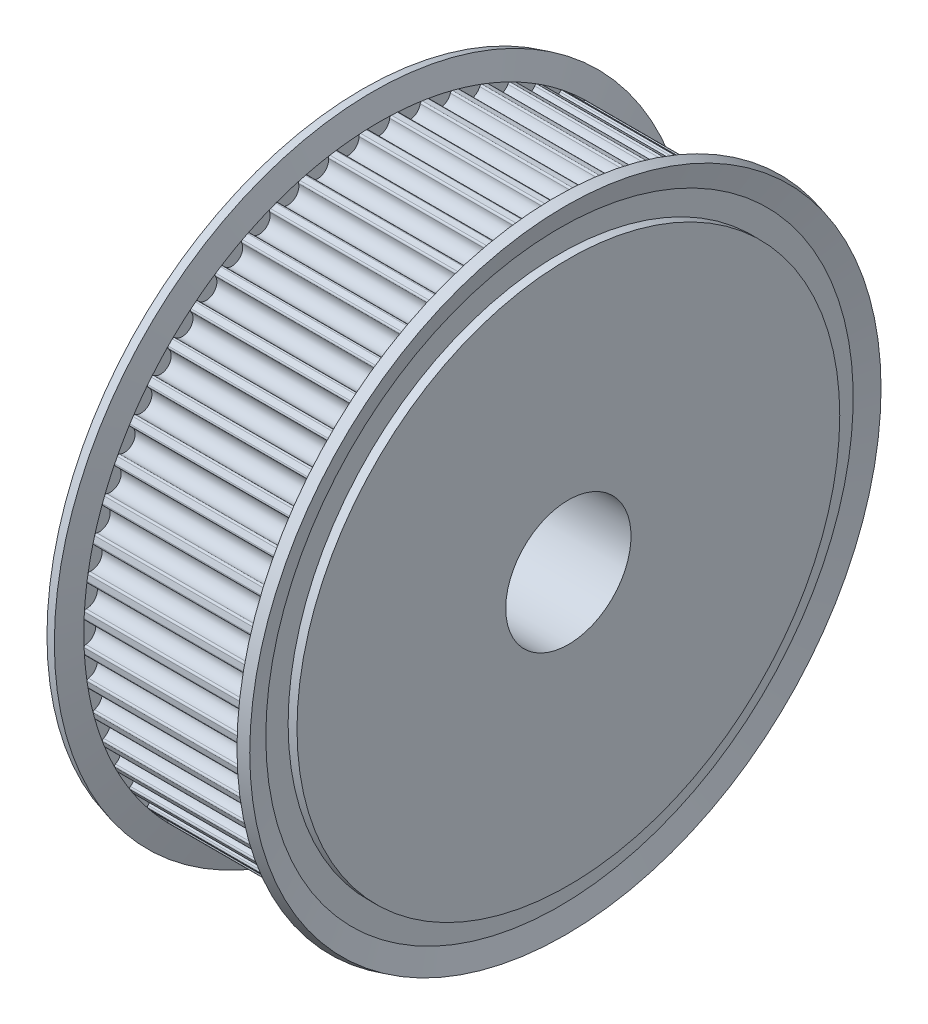
from build123d import *

# Parameters (mm, degrees)
CUT_EXTRUDE1_DEPTH       = 8.15
CUT_EXTRUDE1_DEPTH_BACK  = 8.15
CUT_EXTRUDE2_DEPTH       = 8.15
CUT_EXTRUDE2_DEPTH_BACK  = 8.15
CUT_EXTRUDE3_DEPTH       = 8.15
CUT_EXTRUDE3_DEPTH_BACK  = 8.15
CUT_EXTRUDE4_DEPTH       = 8.15
CUT_EXTRUDE4_DEPTH_BACK  = 8.15
CUT_EXTRUDE5_DEPTH       = 8.15
CUT_EXTRUDE5_DEPTH_BACK  = 8.15
CUT_EXTRUDE6_DEPTH       = 8.15
CUT_EXTRUDE6_DEPTH_BACK  = 8.15
CUT_EXTRUDE7_DEPTH       = 8.15
CUT_EXTRUDE7_DEPTH_BACK  = 8.15
CUT_EXTRUDE8_DEPTH       = 8.15
CUT_EXTRUDE8_DEPTH_BACK  = 8.15
CUT_EXTRUDE9_DEPTH       = 8.15
CUT_EXTRUDE9_DEPTH_BACK  = 8.15
CUT_EXTRUDE10_DEPTH      = 8.15
CUT_EXTRUDE10_DEPTH_BACK = 8.15
CUT_EXTRUDE11_DEPTH      = 8.15
CUT_EXTRUDE11_DEPTH_BACK = 8.15
CUT_EXTRUDE12_DEPTH      = 8.15
CUT_EXTRUDE12_DEPTH_BACK = 8.15
CUT_EXTRUDE13_DEPTH      = 8.15
CUT_EXTRUDE13_DEPTH_BACK = 8.15
CUT_EXTRUDE14_DEPTH      = 8.15
CUT_EXTRUDE14_DEPTH_BACK = 8.15
CUT_EXTRUDE15_DEPTH      = 8.15
CUT_EXTRUDE15_DEPTH_BACK = 8.15
CUT_EXTRUDE16_DEPTH      = 8.15
CUT_EXTRUDE16_DEPTH_BACK = 8.15
CUT_EXTRUDE17_DEPTH      = 8.15
CUT_EXTRUDE17_DEPTH_BACK = 8.15
CUT_EXTRUDE18_DEPTH      = 8.15
CUT_EXTRUDE18_DEPTH_BACK = 8.15
CUT_EXTRUDE19_DEPTH      = 8.15
CUT_EXTRUDE19_DEPTH_BACK = 8.15
CUT_EXTRUDE20_DEPTH      = 8.15
CUT_EXTRUDE20_DEPTH_BACK = 8.15
CUT_EXTRUDE21_DEPTH      = 8.15
CUT_EXTRUDE21_DEPTH_BACK = 8.15
CUT_EXTRUDE22_DEPTH      = 8.15
CUT_EXTRUDE22_DEPTH_BACK = 8.15
CUT_EXTRUDE23_DEPTH      = 8.15
CUT_EXTRUDE23_DEPTH_BACK = 8.15
CUT_EXTRUDE24_DEPTH      = 8.15
CUT_EXTRUDE24_DEPTH_BACK = 8.15
CUT_EXTRUDE25_DEPTH      = 8.15
CUT_EXTRUDE25_DEPTH_BACK = 8.15
CUT_EXTRUDE26_DEPTH      = 8.15
CUT_EXTRUDE26_DEPTH_BACK = 8.15
CUT_EXTRUDE27_DEPTH      = 8.15
CUT_EXTRUDE27_DEPTH_BACK = 8.15
CUT_EXTRUDE28_DEPTH      = 8.15
CUT_EXTRUDE28_DEPTH_BACK = 8.15
CUT_EXTRUDE29_DEPTH      = 8.15
CUT_EXTRUDE29_DEPTH_BACK = 8.15
CUT_EXTRUDE30_DEPTH      = 8.15
CUT_EXTRUDE30_DEPTH_BACK = 8.15
CUT_EXTRUDE31_DEPTH      = 8.15
CUT_EXTRUDE31_DEPTH_BACK = 8.15
CUT_EXTRUDE32_DEPTH      = 8.15
CUT_EXTRUDE32_DEPTH_BACK = 8.15
CUT_EXTRUDE33_DEPTH      = 8.15
CUT_EXTRUDE33_DEPTH_BACK = 8.15
CUT_EXTRUDE34_DEPTH      = 8.15
CUT_EXTRUDE34_DEPTH_BACK = 8.15
CUT_EXTRUDE35_DEPTH      = 8.15
CUT_EXTRUDE35_DEPTH_BACK = 8.15
CUT_EXTRUDE36_DEPTH      = 8.15
CUT_EXTRUDE36_DEPTH_BACK = 8.15
CUT_EXTRUDE37_DEPTH      = 8.15
CUT_EXTRUDE37_DEPTH_BACK = 8.15
CUT_EXTRUDE38_DEPTH      = 8.15
CUT_EXTRUDE38_DEPTH_BACK = 8.15
CUT_EXTRUDE39_DEPTH      = 8.15
CUT_EXTRUDE39_DEPTH_BACK = 8.15
CUT_EXTRUDE40_DEPTH      = 8.15
CUT_EXTRUDE40_DEPTH_BACK = 8.15
CUT_EXTRUDE41_DEPTH      = 8.15
CUT_EXTRUDE41_DEPTH_BACK = 8.15
CUT_EXTRUDE42_DEPTH      = 8.15
CUT_EXTRUDE42_DEPTH_BACK = 8.15
CUT_EXTRUDE43_DEPTH      = 8.15
CUT_EXTRUDE43_DEPTH_BACK = 8.15
CUT_EXTRUDE44_DEPTH      = 8.15
CUT_EXTRUDE44_DEPTH_BACK = 8.15
CUT_EXTRUDE45_DEPTH      = 8.15
CUT_EXTRUDE45_DEPTH_BACK = 8.15
CUT_EXTRUDE46_DEPTH      = 8.15
CUT_EXTRUDE46_DEPTH_BACK = 8.15
CUT_EXTRUDE47_DEPTH      = 8.15
CUT_EXTRUDE47_DEPTH_BACK = 8.15
CUT_EXTRUDE48_DEPTH      = 8.15
CUT_EXTRUDE48_DEPTH_BACK = 8.15
CUT_EXTRUDE49_DEPTH      = 8.15
CUT_EXTRUDE49_DEPTH_BACK = 8.15
CUT_EXTRUDE50_DEPTH      = 8.15
CUT_EXTRUDE50_DEPTH_BACK = 8.15
CUT_EXTRUDE51_DEPTH      = 8.15
CUT_EXTRUDE51_DEPTH_BACK = 8.15
CUT_EXTRUDE52_DEPTH      = 8.15
CUT_EXTRUDE52_DEPTH_BACK = 8.15
CUT_EXTRUDE53_DEPTH      = 8.15
CUT_EXTRUDE53_DEPTH_BACK = 8.15
CUT_EXTRUDE54_DEPTH      = 8.15
CUT_EXTRUDE54_DEPTH_BACK = 8.15
CUT_EXTRUDE55_DEPTH      = 8.15
CUT_EXTRUDE55_DEPTH_BACK = 8.15
CUT_EXTRUDE56_DEPTH      = 8.15
CUT_EXTRUDE56_DEPTH_BACK = 8.15
CUT_EXTRUDE57_DEPTH      = 8.15
CUT_EXTRUDE57_DEPTH_BACK = 8.15
CUT_EXTRUDE58_DEPTH      = 8.15
CUT_EXTRUDE58_DEPTH_BACK = 8.15
CUT_EXTRUDE59_DEPTH      = 8.15
CUT_EXTRUDE59_DEPTH_BACK = 8.15
CUT_EXTRUDE60_DEPTH      = 8.15
CUT_EXTRUDE60_DEPTH_BACK = 8.15
SKETCH62_W               = 20
SKETCH62_H               = 6


with BuildPart() as part:
    # Sketch1 → Revolve1 (revolve)
    with BuildSketch(Plane.XY):
        Polygon((0, 0), (0, 26), (0.85, 26), (0.85, 28.138347502), (0.286547475, 30.241180955), (1.252473301, 30.5), (1.85, 28.27), (18.15, 28.27), (18.747526699, 30.5), (19.713452525, 30.241180955), (19.15, 28.138347502), (19.15, 26), (20, 26), (20, 0), align=None)
    revolve(axis=Axis((20, 0, 0), (-1, 0, 0)))

    # Sketch2 → Cut-Extrude1 (cut, two sides: drawn at the far end of the back side and taken through both)
    with BuildSketch(Plane(origin=(10, 0, 0), x_dir=(0, 0, -1), z_dir=(1, 0, 0)).offset(-CUT_EXTRUDE1_DEPTH_BACK)):
        with BuildLine():
            Line((-1.220377727, 28.623996545), (-1.204191216, 28.244341442))
            ThreePointArc((-1.204191216, 28.244341442), (-1.083780205, 28.201352445), (-1.027381979, 28.086608793))
            ThreePointArc((-1.027381979, 28.086608793), (5e-08, 27.13), (1.027381986, 28.086608894))
            ThreePointArc((1.027381986, 28.086608894), (1.083780242, 28.201352479), (1.204191216, 28.244341442))
            Line((1.204191216, 28.244341442), (1.220377727, 28.623996545))
            ThreePointArc((1.220377727, 28.623996545), (0, 28.65), (-1.220377727, 28.623996545))
        make_face()
    extrude(amount=CUT_EXTRUDE1_DEPTH + CUT_EXTRUDE1_DEPTH_BACK, mode=Mode.SUBTRACT)

    # Sketch3 → Cut-Extrude2 (cut, two sides: drawn at the far end of the back side and taken through both)
    with BuildSketch(Plane(origin=(10, 0, 0), x_dir=(0, 0, -1), z_dir=(1, 0, 0)).offset(-CUT_EXTRUDE2_DEPTH_BACK)):
        with BuildLine():
            Line((-4.205714742, 28.339627088), (-4.149932138, 27.963743727))
            ThreePointArc((-4.149932138, 27.963743727), (-4.025687177, 27.933576607), (-3.957603929, 27.825356752))
            ThreePointArc((-3.957603929, 27.825356752), (-2.835857158, 26.981379027), (-1.914096186, 28.040138172))
            ThreePointArc((-1.914096186, 28.040138172), (-1.870000856, 28.160148403), (-1.754743076, 28.215488242))
            Line((-1.754743076, 28.215488242), (-1.778330001, 28.594755505))
            ThreePointArc((-1.778330001, 28.594755505), (-2.994740473, 28.493052302), (-4.205714742, 28.339627088))
        make_face()
    extrude(amount=CUT_EXTRUDE2_DEPTH + CUT_EXTRUDE2_DEPTH_BACK, mode=Mode.SUBTRACT)

    # Sketch4 → Cut-Extrude3 (cut, two sides: drawn at the far end of the back side and taken through both)
    with BuildSketch(Plane(origin=(10, 0, 0), x_dir=(0, 0, -1), z_dir=(1, 0, 0)).offset(-CUT_EXTRUDE3_DEPTH_BACK)):
        with BuildLine():
            Line((-7.144973065, 27.744762747), (-7.050205534, 27.376769384))
            ThreePointArc((-7.050205534, 27.376769384), (-6.923487877, 27.359754657), (-6.844465541, 27.25924428))
            ThreePointArc((-6.844465541, 27.25924428), (-5.640644123, 26.537144418), (-4.83460312, 27.686453828))
            ThreePointArc((-4.83460312, 27.686453828), (-4.803293833, 27.810415847), (-4.694452036, 27.877500248))
            Line((-4.694452036, 27.877500248), (-4.757553974, 28.252224341))
            ThreePointArc((-4.757553974, 28.252224341), (-5.956669942, 28.023928761), (-7.144973065, 27.744762747))
        make_face()
    extrude(amount=CUT_EXTRUDE3_DEPTH + CUT_EXTRUDE3_DEPTH_BACK, mode=Mode.SUBTRACT)

    # Sketch5 → Cut-Extrude4 (cut, two sides: drawn at the far end of the back side and taken through both)
    with BuildSketch(Plane(origin=(10, 0, 0), x_dir=(0, 0, -1), z_dir=(1, 0, 0)).offset(-CUT_EXTRUDE4_DEPTH_BACK)):
        with BuildLine():
            Line((-10.005949569, 26.845920979), (-9.873235404, 26.489849427))
            ThreePointArc((-9.873235404, 26.489849427), (-9.745433396, 26.48617351), (-9.656337757, 26.394473822))
            ThreePointArc((-9.656337757, 26.394473822), (-8.383631009, 25.802163303), (-7.70214113, 27.029430903))
            ThreePointArc((-7.70214113, 27.029430903), (-7.683960919, 27.155986556), (-7.582727597, 27.234080528))
            Line((-7.582727597, 27.234080528), (-7.68465319, 27.600155894))
            ThreePointArc((-7.68465319, 27.600155894), (-8.853336889, 27.247769192), (-10.005949569, 26.845920979))
        make_face()
    extrude(amount=CUT_EXTRUDE4_DEPTH + CUT_EXTRUDE4_DEPTH_BACK, mode=Mode.SUBTRACT)

    # Sketch6 → Cut-Extrude5 (cut, two sides: drawn at the far end of the back side and taken through both)
    with BuildSketch(Plane(origin=(10, 0, 0), x_dir=(0, 0, -1), z_dir=(1, 0, 0)).offset(-CUT_EXTRUDE5_DEPTH_BACK)):
        with BuildLine():
            Line((-12.757298795, 25.652949683), (-12.58809204, 25.312701136))
            ThreePointArc((-12.58809204, 25.312701136), (-12.460605907, 25.322404304), (-12.362413116, 25.240519986))
            ThreePointArc((-12.362413116, 25.240519986), (-11.034765081, 24.784488286), (-10.48529287, 26.076267876))
            ThreePointArc((-10.48529287, 26.076267876), (-10.48044092, 26.204030594), (-10.387925208, 26.292278522))
            Line((-10.387925208, 26.292278522), (-10.527557737, 26.645694363))
            ThreePointArc((-10.527557737, 26.645694363), (-11.653004824, 26.173077361), (-12.757298795, 25.652949683))
        make_face()
    extrude(amount=CUT_EXTRUDE5_DEPTH + CUT_EXTRUDE5_DEPTH_BACK, mode=Mode.SUBTRACT)

    # Sketch7 → Cut-Extrude6 (cut, two sides: drawn at the far end of the back side and taken through both)
    with BuildSketch(Plane(origin=(10, 0, 0), x_dir=(0, 0, -1), z_dir=(1, 0, 0)).offset(-CUT_EXTRUDE6_DEPTH_BACK)):
        with BuildLine():
            Line((-15.368876386, 24.178919302), (-15.165030906, 23.858221594))
            ThreePointArc((-15.165030906, 23.858221594), (-15.039257412, 23.881197536), (-14.93304329, 23.810025732))
            ThreePointArc((-14.93304329, 23.810025732), (-13.564999956, 23.49526923), (-13.153565547, 24.837407801))
            ThreePointArc((-13.153565547, 24.837407801), (-13.162095017, 24.964977789), (-13.079310537, 25.06241281))
            Line((-13.079310537, 25.06241281), (-13.255120158, 25.399297029))
            ThreePointArc((-13.255120158, 25.399297029), (-14.325, 24.811627818), (-15.368876386, 24.178919302))
        make_face()
    extrude(amount=CUT_EXTRUDE6_DEPTH + CUT_EXTRUDE6_DEPTH_BACK, mode=Mode.SUBTRACT)

    # Sketch8 → Cut-Extrude7 (cut, two sides: drawn at the far end of the back side and taken through both)
    with BuildSketch(Plane(origin=(10, 0, 0), x_dir=(0, 0, -1), z_dir=(1, 0, 0)).offset(-CUT_EXTRUDE7_DEPTH_BACK)):
        with BuildLine():
            Line((-17.812069352, 22.439979621), (-17.575818519, 22.142346384))
            ThreePointArc((-17.575818519, 22.142346384), (-17.453135666, 22.178343372), (-17.340063916, 22.118663852))
            ThreePointArc((-17.340063916, 22.118663852), (-15.946613854, 21.948631087), (-15.677725008, 23.326423889))
            ThreePointArc((-15.677725008, 23.326423889), (-15.699542448, 23.452403463), (-15.627396202, 23.55795806))
            Line((-15.627396202, 23.55795806), (-15.83745671, 23.874619682))
            ThreePointArc((-15.83745671, 23.874619682), (-16.840047478, 23.178336889), (-17.812069352, 22.439979621))
        make_face()
    extrude(amount=CUT_EXTRUDE7_DEPTH + CUT_EXTRUDE7_DEPTH_BACK, mode=Mode.SUBTRACT)

    # Sketch9 → Cut-Extrude8 (cut, two sides: drawn at the far end of the back side and taken through both)
    with BuildSketch(Plane(origin=(10, 0, 0), x_dir=(0, 0, -1), z_dir=(1, 0, 0)).offset(-CUT_EXTRUDE8_DEPTH_BACK)):
        with BuildLine():
            Line((-20.060109558, 20.455182828), (-19.794041787, 20.183874993))
            ThreePointArc((-19.794041787, 20.183874993), (-19.675793713, 20.232498636), (-19.557103174, 20.184965263))
            ThreePointArc((-19.557103174, 20.184965263), (-18.153513313, 20.161519149), (-18.030116033, 21.559870796))
            ThreePointArc((-18.030116033, 21.559870796), (-18.064982405, 21.682879697), (-18.004264844, 21.795397391))
            Line((-18.004264844, 21.795397391), (-18.246274771, 22.088367005))
            ThreePointArc((-18.246274771, 22.088367005), (-19.170591872, 21.29109925), (-20.060109558, 20.455182828))
        make_face()
    extrude(amount=CUT_EXTRUDE8_DEPTH + CUT_EXTRUDE8_DEPTH_BACK, mode=Mode.SUBTRACT)

    # Sketch10 → Cut-Extrude9 (cut, two sides: drawn at the far end of the back side and taken through both)
    with BuildSketch(Plane(origin=(10, 0, 0), x_dir=(0, 0, -1), z_dir=(1, 0, 0)).offset(-CUT_EXTRUDE9_DEPTH_BACK)):
        with BuildLine():
            Line((-22.088367005, 18.246274771), (-21.795397391, 18.004264844))
            ThreePointArc((-21.795397391, 18.004264844), (-21.682879647, 18.064982411), (-21.559870717, 18.030115971))
            ThreePointArc((-21.559870717, 18.030115971), (-20.161519081, 18.153513388), (-20.184965333, 19.557103247))
            ThreePointArc((-20.184965333, 19.557103247), (-20.232498635, 19.675793763), (-20.183874993, 19.794041787))
            Line((-20.183874993, 19.794041787), (-20.455182828, 20.060109558))
            ThreePointArc((-20.455182828, 20.060109558), (-21.29109925, 19.170591872), (-22.088367005, 18.246274771))
        make_face()
    extrude(amount=CUT_EXTRUDE9_DEPTH + CUT_EXTRUDE9_DEPTH_BACK, mode=Mode.SUBTRACT)

    # Sketch11 → Cut-Extrude10 (cut, two sides: drawn at the far end of the back side and taken through both)
    with BuildSketch(Plane(origin=(10, 0, 0), x_dir=(0, 0, -1), z_dir=(1, 0, 0)).offset(-CUT_EXTRUDE10_DEPTH_BACK)):
        with BuildLine():
            Line((-23.874619682, 15.83745671), (-23.55795806, 15.627396202))
            ThreePointArc((-23.55795806, 15.627396202), (-23.452403414, 15.699542458), (-23.326423804, 15.677724955))
            ThreePointArc((-23.326423804, 15.677724955), (-21.948631028, 15.946613935), (-22.11866393, 17.340063981))
            ThreePointArc((-22.11866393, 17.340063981), (-22.178343377, 17.453135716), (-22.142346384, 17.575818519))
            Line((-22.142346384, 17.575818519), (-22.439979621, 17.812069352))
            ThreePointArc((-22.439979621, 17.812069352), (-23.178336889, 16.840047478), (-23.874619682, 15.83745671))
        make_face()
    extrude(amount=CUT_EXTRUDE10_DEPTH + CUT_EXTRUDE10_DEPTH_BACK, mode=Mode.SUBTRACT)

    # Sketch12 → Cut-Extrude11 (cut, two sides: drawn at the far end of the back side and taken through both)
    with BuildSketch(Plane(origin=(10, 0, 0), x_dir=(0, 0, -1), z_dir=(1, 0, 0)).offset(-CUT_EXTRUDE11_DEPTH_BACK)):
        with BuildLine():
            Line((-25.399297029, 13.255120158), (-25.06241281, 13.079310537))
            ThreePointArc((-25.06241281, 13.079310537), (-24.964977741, 13.162095033), (-24.837407711, 13.153565503))
            ThreePointArc((-24.837407711, 13.153565503), (-23.495269179, 13.565000044), (-23.810025815, 14.933043346))
            ThreePointArc((-23.810025815, 14.933043346), (-23.881197547, 15.039257461), (-23.858221594, 15.165030906))
            Line((-23.858221594, 15.165030906), (-24.178919302, 15.368876386))
            ThreePointArc((-24.178919302, 15.368876386), (-24.811627818, 14.325), (-25.399297029, 13.255120158))
        make_face()
    extrude(amount=CUT_EXTRUDE11_DEPTH + CUT_EXTRUDE11_DEPTH_BACK, mode=Mode.SUBTRACT)

    # Sketch13 → Cut-Extrude12 (cut, two sides: drawn at the far end of the back side and taken through both)
    with BuildSketch(Plane(origin=(10, 0, 0), x_dir=(0, 0, -1), z_dir=(1, 0, 0)).offset(-CUT_EXTRUDE12_DEPTH_BACK)):
        with BuildLine():
            Line((-26.645694363, 10.527557737), (-26.292278522, 10.387925208))
            ThreePointArc((-26.292278522, 10.387925208), (-26.204030548, 10.480440941), (-26.076267781, 10.485292836))
            ThreePointArc((-26.076267781, 10.485292836), (-24.784488245, 11.034765173), (-25.240520075, 12.362413164))
            ThreePointArc((-25.240520075, 12.362413164), (-25.322404319, 12.460605955), (-25.312701136, 12.58809204))
            Line((-25.312701136, 12.58809204), (-25.652949683, 12.757298795))
            ThreePointArc((-25.652949683, 12.757298795), (-26.173077361, 11.653004824), (-26.645694363, 10.527557737))
        make_face()
    extrude(amount=CUT_EXTRUDE12_DEPTH + CUT_EXTRUDE12_DEPTH_BACK, mode=Mode.SUBTRACT)

    # Sketch14 → Cut-Extrude13 (cut, two sides: drawn at the far end of the back side and taken through both)
    with BuildSketch(Plane(origin=(10, 0, 0), x_dir=(0, 0, -1), z_dir=(1, 0, 0)).offset(-CUT_EXTRUDE13_DEPTH_BACK)):
        with BuildLine():
            Line((-27.600155894, 7.68465319), (-27.234080528, 7.582727597))
            ThreePointArc((-27.234080528, 7.582727597), (-27.155986513, 7.683960944), (-27.029430805, 7.702141106))
            ThreePointArc((-27.029430805, 7.702141106), (-25.802163272, 8.383631105), (-26.394473916, 9.656337795))
            ThreePointArc((-26.394473916, 9.656337795), (-26.48617353, 9.745433442), (-26.489849427, 9.873235404))
            Line((-26.489849427, 9.873235404), (-26.845920979, 10.005949569))
            ThreePointArc((-26.845920979, 10.005949569), (-27.247769192, 8.853336889), (-27.600155894, 7.68465319))
        make_face()
    extrude(amount=CUT_EXTRUDE13_DEPTH + CUT_EXTRUDE13_DEPTH_BACK, mode=Mode.SUBTRACT)

    # Sketch15 → Cut-Extrude14 (cut, two sides: drawn at the far end of the back side and taken through both)
    with BuildSketch(Plane(origin=(10, 0, 0), x_dir=(0, 0, -1), z_dir=(1, 0, 0)).offset(-CUT_EXTRUDE14_DEPTH_BACK)):
        with BuildLine():
            Line((-28.252224341, 4.757553974), (-27.877500248, 4.694452036))
            ThreePointArc((-27.877500248, 4.694452036), (-27.810415807, 4.803293863), (-27.686453728, 4.834603106))
            ThreePointArc((-27.686453728, 4.834603106), (-26.537144397, 5.640644221), (-27.259244376, 6.844465569))
            ThreePointArc((-27.259244376, 6.844465569), (-27.359754682, 6.923487921), (-27.376769384, 7.050205534))
            Line((-27.376769384, 7.050205534), (-27.744762747, 7.144973065))
            ThreePointArc((-27.744762747, 7.144973065), (-28.023928761, 5.956669942), (-28.252224341, 4.757553974))
        make_face()
    extrude(amount=CUT_EXTRUDE14_DEPTH + CUT_EXTRUDE14_DEPTH_BACK, mode=Mode.SUBTRACT)

    # Sketch16 → Cut-Extrude15 (cut, two sides: drawn at the far end of the back side and taken through both)
    with BuildSketch(Plane(origin=(10, 0, 0), x_dir=(0, 0, -1), z_dir=(1, 0, 0)).offset(-CUT_EXTRUDE15_DEPTH_BACK)):
        with BuildLine():
            Line((-28.594755505, 1.778330001), (-28.215488242, 1.754743076))
            ThreePointArc((-28.215488242, 1.754743076), (-28.160148365, 1.87000089), (-28.040138071, 1.914096183))
            ThreePointArc((-28.040138071, 1.914096183), (-26.981379016, 2.835857259), (-27.825356851, 3.957603946))
            ThreePointArc((-27.825356851, 3.957603946), (-27.933576636, 4.025687218), (-27.963743727, 4.149932138))
            Line((-27.963743727, 4.149932138), (-28.339627088, 4.205714742))
            ThreePointArc((-28.339627088, 4.205714742), (-28.493052302, 2.994740473), (-28.594755505, 1.778330001))
        make_face()
    extrude(amount=CUT_EXTRUDE15_DEPTH + CUT_EXTRUDE15_DEPTH_BACK, mode=Mode.SUBTRACT)

    # Sketch17 → Cut-Extrude16 (cut, two sides: drawn at the far end of the back side and taken through both)
    with BuildSketch(Plane(origin=(10, 0, 0), x_dir=(0, 0, -1), z_dir=(1, 0, 0)).offset(-CUT_EXTRUDE16_DEPTH_BACK)):
        with BuildLine():
            Line((-28.623996545, -1.220377727), (-28.244341442, -1.204191216))
            ThreePointArc((-28.244341442, -1.204191216), (-28.201352445, -1.083780205), (-28.086608793, -1.027381979))
            ThreePointArc((-28.086608793, -1.027381979), (-27.13, 5e-08), (-28.086608894, 1.027381986))
            ThreePointArc((-28.086608894, 1.027381986), (-28.201352479, 1.083780242), (-28.244341442, 1.204191216))
            Line((-28.244341442, 1.204191216), (-28.623996545, 1.220377727))
            ThreePointArc((-28.623996545, 1.220377727), (-28.65, 0), (-28.623996545, -1.220377727))
        make_face()
    extrude(amount=CUT_EXTRUDE16_DEPTH + CUT_EXTRUDE16_DEPTH_BACK, mode=Mode.SUBTRACT)

    # Sketch18 → Cut-Extrude17 (cut, two sides: drawn at the far end of the back side and taken through both)
    with BuildSketch(Plane(origin=(10, 0, 0), x_dir=(0, 0, -1), z_dir=(1, 0, 0)).offset(-CUT_EXTRUDE17_DEPTH_BACK)):
        with BuildLine():
            Line((-28.339627088, -4.205714742), (-27.963743727, -4.149932138))
            ThreePointArc((-27.963743727, -4.149932138), (-27.933576607, -4.025687177), (-27.825356752, -3.957603929))
            ThreePointArc((-27.825356752, -3.957603929), (-26.981379027, -2.835857158), (-28.040138172, -1.914096186))
            ThreePointArc((-28.040138172, -1.914096186), (-28.160148403, -1.870000856), (-28.215488242, -1.754743076))
            Line((-28.215488242, -1.754743076), (-28.594755505, -1.778330001))
            ThreePointArc((-28.594755505, -1.778330001), (-28.493052302, -2.994740473), (-28.339627088, -4.205714742))
        make_face()
    extrude(amount=CUT_EXTRUDE17_DEPTH + CUT_EXTRUDE17_DEPTH_BACK, mode=Mode.SUBTRACT)

    # Sketch19 → Cut-Extrude18 (cut, two sides: drawn at the far end of the back side and taken through both)
    with BuildSketch(Plane(origin=(10, 0, 0), x_dir=(0, 0, -1), z_dir=(1, 0, 0)).offset(-CUT_EXTRUDE18_DEPTH_BACK)):
        with BuildLine():
            Line((-27.744762747, -7.144973065), (-27.376769384, -7.050205534))
            ThreePointArc((-27.376769384, -7.050205534), (-27.359754657, -6.923487877), (-27.25924428, -6.844465541))
            ThreePointArc((-27.25924428, -6.844465541), (-26.537144418, -5.640644123), (-27.686453828, -4.83460312))
            ThreePointArc((-27.686453828, -4.83460312), (-27.810415847, -4.803293833), (-27.877500248, -4.694452036))
            Line((-27.877500248, -4.694452036), (-28.252224341, -4.757553974))
            ThreePointArc((-28.252224341, -4.757553974), (-28.023928761, -5.956669942), (-27.744762747, -7.144973065))
        make_face()
    extrude(amount=CUT_EXTRUDE18_DEPTH + CUT_EXTRUDE18_DEPTH_BACK, mode=Mode.SUBTRACT)

    # Sketch20 → Cut-Extrude19 (cut, two sides: drawn at the far end of the back side and taken through both)
    with BuildSketch(Plane(origin=(10, 0, 0), x_dir=(0, 0, -1), z_dir=(1, 0, 0)).offset(-CUT_EXTRUDE19_DEPTH_BACK)):
        with BuildLine():
            Line((-26.845920979, -10.005949569), (-26.489849427, -9.873235404))
            ThreePointArc((-26.489849427, -9.873235404), (-26.48617351, -9.745433396), (-26.394473822, -9.656337757))
            ThreePointArc((-26.394473822, -9.656337757), (-25.802163303, -8.383631009), (-27.029430903, -7.70214113))
            ThreePointArc((-27.029430903, -7.70214113), (-27.155986556, -7.683960919), (-27.234080528, -7.582727597))
            Line((-27.234080528, -7.582727597), (-27.600155894, -7.68465319))
            ThreePointArc((-27.600155894, -7.68465319), (-27.247769192, -8.853336889), (-26.845920979, -10.005949569))
        make_face()
    extrude(amount=CUT_EXTRUDE19_DEPTH + CUT_EXTRUDE19_DEPTH_BACK, mode=Mode.SUBTRACT)

    # Sketch21 → Cut-Extrude20 (cut, two sides: drawn at the far end of the back side and taken through both)
    with BuildSketch(Plane(origin=(10, 0, 0), x_dir=(0, 0, -1), z_dir=(1, 0, 0)).offset(-CUT_EXTRUDE20_DEPTH_BACK)):
        with BuildLine():
            Line((-25.652949683, -12.757298795), (-25.312701136, -12.58809204))
            ThreePointArc((-25.312701136, -12.58809204), (-25.322404304, -12.460605907), (-25.240519986, -12.362413116))
            ThreePointArc((-25.240519986, -12.362413116), (-24.784488286, -11.034765081), (-26.076267876, -10.48529287))
            ThreePointArc((-26.076267876, -10.48529287), (-26.204030594, -10.48044092), (-26.292278522, -10.387925208))
            Line((-26.292278522, -10.387925208), (-26.645694363, -10.527557737))
            ThreePointArc((-26.645694363, -10.527557737), (-26.173077361, -11.653004824), (-25.652949683, -12.757298795))
        make_face()
    extrude(amount=CUT_EXTRUDE20_DEPTH + CUT_EXTRUDE20_DEPTH_BACK, mode=Mode.SUBTRACT)

    # Sketch22 → Cut-Extrude21 (cut, two sides: drawn at the far end of the back side and taken through both)
    with BuildSketch(Plane(origin=(10, 0, 0), x_dir=(0, 0, -1), z_dir=(1, 0, 0)).offset(-CUT_EXTRUDE21_DEPTH_BACK)):
        with BuildLine():
            Line((-24.178919302, -15.368876386), (-23.858221594, -15.165030906))
            ThreePointArc((-23.858221594, -15.165030906), (-23.881197536, -15.039257412), (-23.810025732, -14.93304329))
            ThreePointArc((-23.810025732, -14.93304329), (-23.49526923, -13.564999956), (-24.837407801, -13.153565547))
            ThreePointArc((-24.837407801, -13.153565547), (-24.964977789, -13.162095017), (-25.06241281, -13.079310537))
            Line((-25.06241281, -13.079310537), (-25.399297029, -13.255120158))
            ThreePointArc((-25.399297029, -13.255120158), (-24.811627818, -14.325), (-24.178919302, -15.368876386))
        make_face()
    extrude(amount=CUT_EXTRUDE21_DEPTH + CUT_EXTRUDE21_DEPTH_BACK, mode=Mode.SUBTRACT)

    # Sketch23 → Cut-Extrude22 (cut, two sides: drawn at the far end of the back side and taken through both)
    with BuildSketch(Plane(origin=(10, 0, 0), x_dir=(0, 0, -1), z_dir=(1, 0, 0)).offset(-CUT_EXTRUDE22_DEPTH_BACK)):
        with BuildLine():
            Line((-22.439979621, -17.812069352), (-22.142346384, -17.575818519))
            ThreePointArc((-22.142346384, -17.575818519), (-22.178343372, -17.453135666), (-22.118663852, -17.340063916))
            ThreePointArc((-22.118663852, -17.340063916), (-21.948631087, -15.946613854), (-23.326423889, -15.677725008))
            ThreePointArc((-23.326423889, -15.677725008), (-23.452403463, -15.699542448), (-23.55795806, -15.627396202))
            Line((-23.55795806, -15.627396202), (-23.874619682, -15.83745671))
            ThreePointArc((-23.874619682, -15.83745671), (-23.178336889, -16.840047478), (-22.439979621, -17.812069352))
        make_face()
    extrude(amount=CUT_EXTRUDE22_DEPTH + CUT_EXTRUDE22_DEPTH_BACK, mode=Mode.SUBTRACT)

    # Sketch24 → Cut-Extrude23 (cut, two sides: drawn at the far end of the back side and taken through both)
    with BuildSketch(Plane(origin=(10, 0, 0), x_dir=(0, 0, -1), z_dir=(1, 0, 0)).offset(-CUT_EXTRUDE23_DEPTH_BACK)):
        with BuildLine():
            Line((-20.455182828, -20.060109558), (-20.183874993, -19.794041787))
            ThreePointArc((-20.183874993, -19.794041787), (-20.232498636, -19.675793713), (-20.184965263, -19.557103174))
            ThreePointArc((-20.184965263, -19.557103174), (-20.161519149, -18.153513313), (-21.559870796, -18.030116033))
            ThreePointArc((-21.559870796, -18.030116033), (-21.682879697, -18.064982405), (-21.795397391, -18.004264844))
            Line((-21.795397391, -18.004264844), (-22.088367005, -18.246274771))
            ThreePointArc((-22.088367005, -18.246274771), (-21.29109925, -19.170591872), (-20.455182828, -20.060109558))
        make_face()
    extrude(amount=CUT_EXTRUDE23_DEPTH + CUT_EXTRUDE23_DEPTH_BACK, mode=Mode.SUBTRACT)

    # Sketch25 → Cut-Extrude24 (cut, two sides: drawn at the far end of the back side and taken through both)
    with BuildSketch(Plane(origin=(10, 0, 0), x_dir=(0, 0, -1), z_dir=(1, 0, 0)).offset(-CUT_EXTRUDE24_DEPTH_BACK)):
        with BuildLine():
            Line((-18.246274771, -22.088367005), (-18.004264844, -21.795397391))
            ThreePointArc((-18.004264844, -21.795397391), (-18.064982411, -21.682879647), (-18.030115971, -21.559870717))
            ThreePointArc((-18.030115971, -21.559870717), (-18.153513388, -20.161519081), (-19.557103247, -20.184965333))
            ThreePointArc((-19.557103247, -20.184965333), (-19.675793763, -20.232498635), (-19.794041787, -20.183874993))
            Line((-19.794041787, -20.183874993), (-20.060109558, -20.455182828))
            ThreePointArc((-20.060109558, -20.455182828), (-19.170591872, -21.29109925), (-18.246274771, -22.088367005))
        make_face()
    extrude(amount=CUT_EXTRUDE24_DEPTH + CUT_EXTRUDE24_DEPTH_BACK, mode=Mode.SUBTRACT)

    # Sketch26 → Cut-Extrude25 (cut, two sides: drawn at the far end of the back side and taken through both)
    with BuildSketch(Plane(origin=(10, 0, 0), x_dir=(0, 0, -1), z_dir=(1, 0, 0)).offset(-CUT_EXTRUDE25_DEPTH_BACK)):
        with BuildLine():
            Line((-15.83745671, -23.874619682), (-15.627396202, -23.55795806))
            ThreePointArc((-15.627396202, -23.55795806), (-15.699542458, -23.452403414), (-15.677724955, -23.326423804))
            ThreePointArc((-15.677724955, -23.326423804), (-15.946613935, -21.948631028), (-17.340063981, -22.11866393))
            ThreePointArc((-17.340063981, -22.11866393), (-17.453135716, -22.178343377), (-17.575818519, -22.142346384))
            Line((-17.575818519, -22.142346384), (-17.812069352, -22.439979621))
            ThreePointArc((-17.812069352, -22.439979621), (-16.840047478, -23.178336889), (-15.83745671, -23.874619682))
        make_face()
    extrude(amount=CUT_EXTRUDE25_DEPTH + CUT_EXTRUDE25_DEPTH_BACK, mode=Mode.SUBTRACT)

    # Sketch27 → Cut-Extrude26 (cut, two sides: drawn at the far end of the back side and taken through both)
    with BuildSketch(Plane(origin=(10, 0, 0), x_dir=(0, 0, -1), z_dir=(1, 0, 0)).offset(-CUT_EXTRUDE26_DEPTH_BACK)):
        with BuildLine():
            Line((-13.255120158, -25.399297029), (-13.079310537, -25.06241281))
            ThreePointArc((-13.079310537, -25.06241281), (-13.162095033, -24.964977741), (-13.153565503, -24.837407711))
            ThreePointArc((-13.153565503, -24.837407711), (-13.565000044, -23.495269179), (-14.933043346, -23.810025815))
            ThreePointArc((-14.933043346, -23.810025815), (-15.039257461, -23.881197547), (-15.165030906, -23.858221594))
            Line((-15.165030906, -23.858221594), (-15.368876386, -24.178919302))
            ThreePointArc((-15.368876386, -24.178919302), (-14.325, -24.811627818), (-13.255120158, -25.399297029))
        make_face()
    extrude(amount=CUT_EXTRUDE26_DEPTH + CUT_EXTRUDE26_DEPTH_BACK, mode=Mode.SUBTRACT)

    # Sketch28 → Cut-Extrude27 (cut, two sides: drawn at the far end of the back side and taken through both)
    with BuildSketch(Plane(origin=(10, 0, 0), x_dir=(0, 0, -1), z_dir=(1, 0, 0)).offset(-CUT_EXTRUDE27_DEPTH_BACK)):
        with BuildLine():
            Line((-10.527557737, -26.645694363), (-10.387925208, -26.292278522))
            ThreePointArc((-10.387925208, -26.292278522), (-10.480440941, -26.204030548), (-10.485292836, -26.076267781))
            ThreePointArc((-10.485292836, -26.076267781), (-11.034765173, -24.784488245), (-12.362413164, -25.240520075))
            ThreePointArc((-12.362413164, -25.240520075), (-12.460605955, -25.322404319), (-12.58809204, -25.312701136))
            Line((-12.58809204, -25.312701136), (-12.757298795, -25.652949683))
            ThreePointArc((-12.757298795, -25.652949683), (-11.653004824, -26.173077361), (-10.527557737, -26.645694363))
        make_face()
    extrude(amount=CUT_EXTRUDE27_DEPTH + CUT_EXTRUDE27_DEPTH_BACK, mode=Mode.SUBTRACT)

    # Sketch29 → Cut-Extrude28 (cut, two sides: drawn at the far end of the back side and taken through both)
    with BuildSketch(Plane(origin=(10, 0, 0), x_dir=(0, 0, -1), z_dir=(1, 0, 0)).offset(-CUT_EXTRUDE28_DEPTH_BACK)):
        with BuildLine():
            Line((-7.68465319, -27.600155894), (-7.582727597, -27.234080528))
            ThreePointArc((-7.582727597, -27.234080528), (-7.683960944, -27.155986513), (-7.702141106, -27.029430805))
            ThreePointArc((-7.702141106, -27.029430805), (-8.383631105, -25.802163272), (-9.656337795, -26.394473916))
            ThreePointArc((-9.656337795, -26.394473916), (-9.745433442, -26.48617353), (-9.873235404, -26.489849427))
            Line((-9.873235404, -26.489849427), (-10.005949569, -26.845920979))
            ThreePointArc((-10.005949569, -26.845920979), (-8.853336889, -27.247769192), (-7.68465319, -27.600155894))
        make_face()
    extrude(amount=CUT_EXTRUDE28_DEPTH + CUT_EXTRUDE28_DEPTH_BACK, mode=Mode.SUBTRACT)

    # Sketch30 → Cut-Extrude29 (cut, two sides: drawn at the far end of the back side and taken through both)
    with BuildSketch(Plane(origin=(10, 0, 0), x_dir=(0, 0, -1), z_dir=(1, 0, 0)).offset(-CUT_EXTRUDE29_DEPTH_BACK)):
        with BuildLine():
            Line((-4.757553974, -28.252224341), (-4.694452036, -27.877500248))
            ThreePointArc((-4.694452036, -27.877500248), (-4.803293863, -27.810415807), (-4.834603106, -27.686453728))
            ThreePointArc((-4.834603106, -27.686453728), (-5.640644221, -26.537144397), (-6.844465569, -27.259244376))
            ThreePointArc((-6.844465569, -27.259244376), (-6.923487921, -27.359754682), (-7.050205534, -27.376769384))
            Line((-7.050205534, -27.376769384), (-7.144973065, -27.744762747))
            ThreePointArc((-7.144973065, -27.744762747), (-5.956669942, -28.023928761), (-4.757553974, -28.252224341))
        make_face()
    extrude(amount=CUT_EXTRUDE29_DEPTH + CUT_EXTRUDE29_DEPTH_BACK, mode=Mode.SUBTRACT)

    # Sketch31 → Cut-Extrude30 (cut, two sides: drawn at the far end of the back side and taken through both)
    with BuildSketch(Plane(origin=(10, 0, 0), x_dir=(0, 0, -1), z_dir=(1, 0, 0)).offset(-CUT_EXTRUDE30_DEPTH_BACK)):
        with BuildLine():
            Line((-1.778330001, -28.594755505), (-1.754743076, -28.215488242))
            ThreePointArc((-1.754743076, -28.215488242), (-1.87000089, -28.160148365), (-1.914096183, -28.040138071))
            ThreePointArc((-1.914096183, -28.040138071), (-2.835857259, -26.981379016), (-3.957603946, -27.825356851))
            ThreePointArc((-3.957603946, -27.825356851), (-4.025687218, -27.933576636), (-4.149932138, -27.963743727))
            Line((-4.149932138, -27.963743727), (-4.205714742, -28.339627088))
            ThreePointArc((-4.205714742, -28.339627088), (-2.994740473, -28.493052302), (-1.778330001, -28.594755505))
        make_face()
    extrude(amount=CUT_EXTRUDE30_DEPTH + CUT_EXTRUDE30_DEPTH_BACK, mode=Mode.SUBTRACT)

    # Sketch32 → Cut-Extrude31 (cut, two sides: drawn at the far end of the back side and taken through both)
    with BuildSketch(Plane(origin=(10, 0, 0), x_dir=(0, 0, -1), z_dir=(1, 0, 0)).offset(-CUT_EXTRUDE31_DEPTH_BACK)):
        with BuildLine():
            Line((1.220377727, -28.623996545), (1.204191216, -28.244341442))
            ThreePointArc((1.204191216, -28.244341442), (1.083780205, -28.201352445), (1.027381979, -28.086608793))
            ThreePointArc((1.027381979, -28.086608793), (-5e-08, -27.13), (-1.027381986, -28.086608894))
            ThreePointArc((-1.027381986, -28.086608894), (-1.083780242, -28.201352479), (-1.204191216, -28.244341442))
            Line((-1.204191216, -28.244341442), (-1.220377727, -28.623996545))
            ThreePointArc((-1.220377727, -28.623996545), (0, -28.65), (1.220377727, -28.623996545))
        make_face()
    extrude(amount=CUT_EXTRUDE31_DEPTH + CUT_EXTRUDE31_DEPTH_BACK, mode=Mode.SUBTRACT)

    # Sketch33 → Cut-Extrude32 (cut, two sides: drawn at the far end of the back side and taken through both)
    with BuildSketch(Plane(origin=(10, 0, 0), x_dir=(0, 0, -1), z_dir=(1, 0, 0)).offset(-CUT_EXTRUDE32_DEPTH_BACK)):
        with BuildLine():
            Line((4.205714742, -28.339627088), (4.149932138, -27.963743727))
            ThreePointArc((4.149932138, -27.963743727), (4.025687177, -27.933576607), (3.957603929, -27.825356752))
            ThreePointArc((3.957603929, -27.825356752), (2.835857158, -26.981379027), (1.914096186, -28.040138172))
            ThreePointArc((1.914096186, -28.040138172), (1.870000856, -28.160148403), (1.754743076, -28.215488242))
            Line((1.754743076, -28.215488242), (1.778330001, -28.594755505))
            ThreePointArc((1.778330001, -28.594755505), (2.994740473, -28.493052302), (4.205714742, -28.339627088))
        make_face()
    extrude(amount=CUT_EXTRUDE32_DEPTH + CUT_EXTRUDE32_DEPTH_BACK, mode=Mode.SUBTRACT)

    # Sketch34 → Cut-Extrude33 (cut, two sides: drawn at the far end of the back side and taken through both)
    with BuildSketch(Plane(origin=(10, 0, 0), x_dir=(0, 0, -1), z_dir=(1, 0, 0)).offset(-CUT_EXTRUDE33_DEPTH_BACK)):
        with BuildLine():
            Line((7.144973065, -27.744762747), (7.050205534, -27.376769384))
            ThreePointArc((7.050205534, -27.376769384), (6.923487877, -27.359754657), (6.844465541, -27.25924428))
            ThreePointArc((6.844465541, -27.25924428), (5.640644123, -26.537144418), (4.83460312, -27.686453828))
            ThreePointArc((4.83460312, -27.686453828), (4.803293833, -27.810415847), (4.694452036, -27.877500248))
            Line((4.694452036, -27.877500248), (4.757553974, -28.252224341))
            ThreePointArc((4.757553974, -28.252224341), (5.956669942, -28.023928761), (7.144973065, -27.744762747))
        make_face()
    extrude(amount=CUT_EXTRUDE33_DEPTH + CUT_EXTRUDE33_DEPTH_BACK, mode=Mode.SUBTRACT)

    # Sketch35 → Cut-Extrude34 (cut, two sides: drawn at the far end of the back side and taken through both)
    with BuildSketch(Plane(origin=(10, 0, 0), x_dir=(0, 0, -1), z_dir=(1, 0, 0)).offset(-CUT_EXTRUDE34_DEPTH_BACK)):
        with BuildLine():
            Line((10.005949569, -26.845920979), (9.873235404, -26.489849427))
            ThreePointArc((9.873235404, -26.489849427), (9.745433396, -26.48617351), (9.656337757, -26.394473822))
            ThreePointArc((9.656337757, -26.394473822), (8.383631009, -25.802163303), (7.70214113, -27.029430903))
            ThreePointArc((7.70214113, -27.029430903), (7.683960919, -27.155986556), (7.582727597, -27.234080528))
            Line((7.582727597, -27.234080528), (7.68465319, -27.600155894))
            ThreePointArc((7.68465319, -27.600155894), (8.853336889, -27.247769192), (10.005949569, -26.845920979))
        make_face()
    extrude(amount=CUT_EXTRUDE34_DEPTH + CUT_EXTRUDE34_DEPTH_BACK, mode=Mode.SUBTRACT)

    # Sketch36 → Cut-Extrude35 (cut, two sides: drawn at the far end of the back side and taken through both)
    with BuildSketch(Plane(origin=(10, 0, 0), x_dir=(0, 0, -1), z_dir=(1, 0, 0)).offset(-CUT_EXTRUDE35_DEPTH_BACK)):
        with BuildLine():
            Line((12.757298795, -25.652949683), (12.58809204, -25.312701136))
            ThreePointArc((12.58809204, -25.312701136), (12.460605907, -25.322404304), (12.362413116, -25.240519986))
            ThreePointArc((12.362413116, -25.240519986), (11.034765081, -24.784488286), (10.48529287, -26.076267876))
            ThreePointArc((10.48529287, -26.076267876), (10.48044092, -26.204030594), (10.387925208, -26.292278522))
            Line((10.387925208, -26.292278522), (10.527557737, -26.645694363))
            ThreePointArc((10.527557737, -26.645694363), (11.653004824, -26.173077361), (12.757298795, -25.652949683))
        make_face()
    extrude(amount=CUT_EXTRUDE35_DEPTH + CUT_EXTRUDE35_DEPTH_BACK, mode=Mode.SUBTRACT)

    # Sketch37 → Cut-Extrude36 (cut, two sides: drawn at the far end of the back side and taken through both)
    with BuildSketch(Plane(origin=(10, 0, 0), x_dir=(0, 0, -1), z_dir=(1, 0, 0)).offset(-CUT_EXTRUDE36_DEPTH_BACK)):
        with BuildLine():
            Line((15.368876386, -24.178919302), (15.165030906, -23.858221594))
            ThreePointArc((15.165030906, -23.858221594), (15.039257412, -23.881197536), (14.93304329, -23.810025732))
            ThreePointArc((14.93304329, -23.810025732), (13.564999956, -23.49526923), (13.153565547, -24.837407801))
            ThreePointArc((13.153565547, -24.837407801), (13.162095017, -24.964977789), (13.079310537, -25.06241281))
            Line((13.079310537, -25.06241281), (13.255120158, -25.399297029))
            ThreePointArc((13.255120158, -25.399297029), (14.325, -24.811627818), (15.368876386, -24.178919302))
        make_face()
    extrude(amount=CUT_EXTRUDE36_DEPTH + CUT_EXTRUDE36_DEPTH_BACK, mode=Mode.SUBTRACT)

    # Sketch38 → Cut-Extrude37 (cut, two sides: drawn at the far end of the back side and taken through both)
    with BuildSketch(Plane(origin=(10, 0, 0), x_dir=(0, 0, -1), z_dir=(1, 0, 0)).offset(-CUT_EXTRUDE37_DEPTH_BACK)):
        with BuildLine():
            Line((17.812069352, -22.439979621), (17.575818519, -22.142346384))
            ThreePointArc((17.575818519, -22.142346384), (17.453135666, -22.178343372), (17.340063916, -22.118663852))
            ThreePointArc((17.340063916, -22.118663852), (15.946613854, -21.948631087), (15.677725008, -23.326423889))
            ThreePointArc((15.677725008, -23.326423889), (15.699542448, -23.452403463), (15.627396202, -23.55795806))
            Line((15.627396202, -23.55795806), (15.83745671, -23.874619682))
            ThreePointArc((15.83745671, -23.874619682), (16.840047478, -23.178336889), (17.812069352, -22.439979621))
        make_face()
    extrude(amount=CUT_EXTRUDE37_DEPTH + CUT_EXTRUDE37_DEPTH_BACK, mode=Mode.SUBTRACT)

    # Sketch39 → Cut-Extrude38 (cut, two sides: drawn at the far end of the back side and taken through both)
    with BuildSketch(Plane(origin=(10, 0, 0), x_dir=(0, 0, -1), z_dir=(1, 0, 0)).offset(-CUT_EXTRUDE38_DEPTH_BACK)):
        with BuildLine():
            Line((20.060109558, -20.455182828), (19.794041787, -20.183874993))
            ThreePointArc((19.794041787, -20.183874993), (19.675793713, -20.232498636), (19.557103174, -20.184965263))
            ThreePointArc((19.557103174, -20.184965263), (18.153513313, -20.161519149), (18.030116033, -21.559870796))
            ThreePointArc((18.030116033, -21.559870796), (18.064982405, -21.682879697), (18.004264844, -21.795397391))
            Line((18.004264844, -21.795397391), (18.246274771, -22.088367005))
            ThreePointArc((18.246274771, -22.088367005), (19.170591872, -21.29109925), (20.060109558, -20.455182828))
        make_face()
    extrude(amount=CUT_EXTRUDE38_DEPTH + CUT_EXTRUDE38_DEPTH_BACK, mode=Mode.SUBTRACT)

    # Sketch40 → Cut-Extrude39 (cut, two sides: drawn at the far end of the back side and taken through both)
    with BuildSketch(Plane(origin=(10, 0, 0), x_dir=(0, 0, -1), z_dir=(1, 0, 0)).offset(-CUT_EXTRUDE39_DEPTH_BACK)):
        with BuildLine():
            Line((22.088367005, -18.246274771), (21.795397391, -18.004264844))
            ThreePointArc((21.795397391, -18.004264844), (21.682879647, -18.064982411), (21.559870717, -18.030115971))
            ThreePointArc((21.559870717, -18.030115971), (20.161519081, -18.153513388), (20.184965333, -19.557103247))
            ThreePointArc((20.184965333, -19.557103247), (20.232498635, -19.675793763), (20.183874993, -19.794041787))
            Line((20.183874993, -19.794041787), (20.455182828, -20.060109558))
            ThreePointArc((20.455182828, -20.060109558), (21.29109925, -19.170591872), (22.088367005, -18.246274771))
        make_face()
    extrude(amount=CUT_EXTRUDE39_DEPTH + CUT_EXTRUDE39_DEPTH_BACK, mode=Mode.SUBTRACT)

    # Sketch41 → Cut-Extrude40 (cut, two sides: drawn at the far end of the back side and taken through both)
    with BuildSketch(Plane(origin=(10, 0, 0), x_dir=(0, 0, -1), z_dir=(1, 0, 0)).offset(-CUT_EXTRUDE40_DEPTH_BACK)):
        with BuildLine():
            Line((23.874619682, -15.83745671), (23.55795806, -15.627396202))
            ThreePointArc((23.55795806, -15.627396202), (23.452403414, -15.699542458), (23.326423804, -15.677724955))
            ThreePointArc((23.326423804, -15.677724955), (21.948631028, -15.946613935), (22.11866393, -17.340063981))
            ThreePointArc((22.11866393, -17.340063981), (22.178343377, -17.453135716), (22.142346384, -17.575818519))
            Line((22.142346384, -17.575818519), (22.439979621, -17.812069352))
            ThreePointArc((22.439979621, -17.812069352), (23.178336889, -16.840047478), (23.874619682, -15.83745671))
        make_face()
    extrude(amount=CUT_EXTRUDE40_DEPTH + CUT_EXTRUDE40_DEPTH_BACK, mode=Mode.SUBTRACT)

    # Sketch42 → Cut-Extrude41 (cut, two sides: drawn at the far end of the back side and taken through both)
    with BuildSketch(Plane(origin=(10, 0, 0), x_dir=(0, 0, -1), z_dir=(1, 0, 0)).offset(-CUT_EXTRUDE41_DEPTH_BACK)):
        with BuildLine():
            Line((25.399297029, -13.255120158), (25.06241281, -13.079310537))
            ThreePointArc((25.06241281, -13.079310537), (24.964977741, -13.162095033), (24.837407711, -13.153565503))
            ThreePointArc((24.837407711, -13.153565503), (23.495269179, -13.565000044), (23.810025815, -14.933043346))
            ThreePointArc((23.810025815, -14.933043346), (23.881197547, -15.039257461), (23.858221594, -15.165030906))
            Line((23.858221594, -15.165030906), (24.178919302, -15.368876386))
            ThreePointArc((24.178919302, -15.368876386), (24.811627818, -14.325), (25.399297029, -13.255120158))
        make_face()
    extrude(amount=CUT_EXTRUDE41_DEPTH + CUT_EXTRUDE41_DEPTH_BACK, mode=Mode.SUBTRACT)

    # Sketch43 → Cut-Extrude42 (cut, two sides: drawn at the far end of the back side and taken through both)
    with BuildSketch(Plane(origin=(10, 0, 0), x_dir=(0, 0, -1), z_dir=(1, 0, 0)).offset(-CUT_EXTRUDE42_DEPTH_BACK)):
        with BuildLine():
            Line((26.645694363, -10.527557737), (26.292278522, -10.387925208))
            ThreePointArc((26.292278522, -10.387925208), (26.204030548, -10.480440941), (26.076267781, -10.485292836))
            ThreePointArc((26.076267781, -10.485292836), (24.784488245, -11.034765173), (25.240520075, -12.362413164))
            ThreePointArc((25.240520075, -12.362413164), (25.322404319, -12.460605955), (25.312701136, -12.58809204))
            Line((25.312701136, -12.58809204), (25.652949683, -12.757298795))
            ThreePointArc((25.652949683, -12.757298795), (26.173077361, -11.653004824), (26.645694363, -10.527557737))
        make_face()
    extrude(amount=CUT_EXTRUDE42_DEPTH + CUT_EXTRUDE42_DEPTH_BACK, mode=Mode.SUBTRACT)

    # Sketch44 → Cut-Extrude43 (cut, two sides: drawn at the far end of the back side and taken through both)
    with BuildSketch(Plane(origin=(10, 0, 0), x_dir=(0, 0, -1), z_dir=(1, 0, 0)).offset(-CUT_EXTRUDE43_DEPTH_BACK)):
        with BuildLine():
            Line((27.600155894, -7.68465319), (27.234080528, -7.582727597))
            ThreePointArc((27.234080528, -7.582727597), (27.155986513, -7.683960944), (27.029430805, -7.702141106))
            ThreePointArc((27.029430805, -7.702141106), (25.802163272, -8.383631105), (26.394473916, -9.656337795))
            ThreePointArc((26.394473916, -9.656337795), (26.48617353, -9.745433442), (26.489849427, -9.873235404))
            Line((26.489849427, -9.873235404), (26.845920979, -10.005949569))
            ThreePointArc((26.845920979, -10.005949569), (27.247769192, -8.853336889), (27.600155894, -7.68465319))
        make_face()
    extrude(amount=CUT_EXTRUDE43_DEPTH + CUT_EXTRUDE43_DEPTH_BACK, mode=Mode.SUBTRACT)

    # Sketch45 → Cut-Extrude44 (cut, two sides: drawn at the far end of the back side and taken through both)
    with BuildSketch(Plane(origin=(10, 0, 0), x_dir=(0, 0, -1), z_dir=(1, 0, 0)).offset(-CUT_EXTRUDE44_DEPTH_BACK)):
        with BuildLine():
            Line((28.252224341, -4.757553974), (27.877500248, -4.694452036))
            ThreePointArc((27.877500248, -4.694452036), (27.810415807, -4.803293863), (27.686453728, -4.834603106))
            ThreePointArc((27.686453728, -4.834603106), (26.537144397, -5.640644221), (27.259244376, -6.844465569))
            ThreePointArc((27.259244376, -6.844465569), (27.359754682, -6.923487921), (27.376769384, -7.050205534))
            Line((27.376769384, -7.050205534), (27.744762747, -7.144973065))
            ThreePointArc((27.744762747, -7.144973065), (28.023928761, -5.956669942), (28.252224341, -4.757553974))
        make_face()
    extrude(amount=CUT_EXTRUDE44_DEPTH + CUT_EXTRUDE44_DEPTH_BACK, mode=Mode.SUBTRACT)

    # Sketch46 → Cut-Extrude45 (cut, two sides: drawn at the far end of the back side and taken through both)
    with BuildSketch(Plane(origin=(10, 0, 0), x_dir=(0, 0, -1), z_dir=(1, 0, 0)).offset(-CUT_EXTRUDE45_DEPTH_BACK)):
        with BuildLine():
            Line((28.594755505, -1.778330001), (28.215488242, -1.754743076))
            ThreePointArc((28.215488242, -1.754743076), (28.160148365, -1.87000089), (28.040138071, -1.914096183))
            ThreePointArc((28.040138071, -1.914096183), (26.981379016, -2.835857259), (27.825356851, -3.957603946))
            ThreePointArc((27.825356851, -3.957603946), (27.933576636, -4.025687218), (27.963743727, -4.149932138))
            Line((27.963743727, -4.149932138), (28.339627088, -4.205714742))
            ThreePointArc((28.339627088, -4.205714742), (28.493052302, -2.994740473), (28.594755505, -1.778330001))
        make_face()
    extrude(amount=CUT_EXTRUDE45_DEPTH + CUT_EXTRUDE45_DEPTH_BACK, mode=Mode.SUBTRACT)

    # Sketch47 → Cut-Extrude46 (cut, two sides: drawn at the far end of the back side and taken through both)
    with BuildSketch(Plane(origin=(10, 0, 0), x_dir=(0, 0, -1), z_dir=(1, 0, 0)).offset(-CUT_EXTRUDE46_DEPTH_BACK)):
        with BuildLine():
            Line((28.623996545, 1.220377727), (28.244341442, 1.204191216))
            ThreePointArc((28.244341442, 1.204191216), (28.201352445, 1.083780205), (28.086608793, 1.027381979))
            ThreePointArc((28.086608793, 1.027381979), (27.13, -5e-08), (28.086608894, -1.027381986))
            ThreePointArc((28.086608894, -1.027381986), (28.201352479, -1.083780242), (28.244341442, -1.204191216))
            Line((28.244341442, -1.204191216), (28.623996545, -1.220377727))
            ThreePointArc((28.623996545, -1.220377727), (28.65, 0), (28.623996545, 1.220377727))
        make_face()
    extrude(amount=CUT_EXTRUDE46_DEPTH + CUT_EXTRUDE46_DEPTH_BACK, mode=Mode.SUBTRACT)

    # Sketch48 → Cut-Extrude47 (cut, two sides: drawn at the far end of the back side and taken through both)
    with BuildSketch(Plane(origin=(10, 0, 0), x_dir=(0, 0, -1), z_dir=(1, 0, 0)).offset(-CUT_EXTRUDE47_DEPTH_BACK)):
        with BuildLine():
            Line((28.339627088, 4.205714742), (27.963743727, 4.149932138))
            ThreePointArc((27.963743727, 4.149932138), (27.933576607, 4.025687177), (27.825356752, 3.957603929))
            ThreePointArc((27.825356752, 3.957603929), (26.981379027, 2.835857158), (28.040138172, 1.914096186))
            ThreePointArc((28.040138172, 1.914096186), (28.160148403, 1.870000856), (28.215488242, 1.754743076))
            Line((28.215488242, 1.754743076), (28.594755505, 1.778330001))
            ThreePointArc((28.594755505, 1.778330001), (28.493052302, 2.994740473), (28.339627088, 4.205714742))
        make_face()
    extrude(amount=CUT_EXTRUDE47_DEPTH + CUT_EXTRUDE47_DEPTH_BACK, mode=Mode.SUBTRACT)

    # Sketch49 → Cut-Extrude48 (cut, two sides: drawn at the far end of the back side and taken through both)
    with BuildSketch(Plane(origin=(10, 0, 0), x_dir=(0, 0, -1), z_dir=(1, 0, 0)).offset(-CUT_EXTRUDE48_DEPTH_BACK)):
        with BuildLine():
            Line((27.744762747, 7.144973065), (27.376769384, 7.050205534))
            ThreePointArc((27.376769384, 7.050205534), (27.359754657, 6.923487877), (27.25924428, 6.844465541))
            ThreePointArc((27.25924428, 6.844465541), (26.537144418, 5.640644123), (27.686453828, 4.83460312))
            ThreePointArc((27.686453828, 4.83460312), (27.810415847, 4.803293833), (27.877500248, 4.694452036))
            Line((27.877500248, 4.694452036), (28.252224341, 4.757553974))
            ThreePointArc((28.252224341, 4.757553974), (28.023928761, 5.956669942), (27.744762747, 7.144973065))
        make_face()
    extrude(amount=CUT_EXTRUDE48_DEPTH + CUT_EXTRUDE48_DEPTH_BACK, mode=Mode.SUBTRACT)

    # Sketch50 → Cut-Extrude49 (cut, two sides: drawn at the far end of the back side and taken through both)
    with BuildSketch(Plane(origin=(10, 0, 0), x_dir=(0, 0, -1), z_dir=(1, 0, 0)).offset(-CUT_EXTRUDE49_DEPTH_BACK)):
        with BuildLine():
            Line((26.845920979, 10.005949569), (26.489849427, 9.873235404))
            ThreePointArc((26.489849427, 9.873235404), (26.48617351, 9.745433396), (26.394473822, 9.656337757))
            ThreePointArc((26.394473822, 9.656337757), (25.802163303, 8.383631009), (27.029430903, 7.70214113))
            ThreePointArc((27.029430903, 7.70214113), (27.155986556, 7.683960919), (27.234080528, 7.582727597))
            Line((27.234080528, 7.582727597), (27.600155894, 7.68465319))
            ThreePointArc((27.600155894, 7.68465319), (27.247769192, 8.853336889), (26.845920979, 10.005949569))
        make_face()
    extrude(amount=CUT_EXTRUDE49_DEPTH + CUT_EXTRUDE49_DEPTH_BACK, mode=Mode.SUBTRACT)

    # Sketch51 → Cut-Extrude50 (cut, two sides: drawn at the far end of the back side and taken through both)
    with BuildSketch(Plane(origin=(10, 0, 0), x_dir=(0, 0, -1), z_dir=(1, 0, 0)).offset(-CUT_EXTRUDE50_DEPTH_BACK)):
        with BuildLine():
            Line((25.652949683, 12.757298795), (25.312701136, 12.58809204))
            ThreePointArc((25.312701136, 12.58809204), (25.322404304, 12.460605907), (25.240519986, 12.362413116))
            ThreePointArc((25.240519986, 12.362413116), (24.784488286, 11.034765081), (26.076267876, 10.48529287))
            ThreePointArc((26.076267876, 10.48529287), (26.204030594, 10.48044092), (26.292278522, 10.387925208))
            Line((26.292278522, 10.387925208), (26.645694363, 10.527557737))
            ThreePointArc((26.645694363, 10.527557737), (26.173077361, 11.653004824), (25.652949683, 12.757298795))
        make_face()
    extrude(amount=CUT_EXTRUDE50_DEPTH + CUT_EXTRUDE50_DEPTH_BACK, mode=Mode.SUBTRACT)

    # Sketch52 → Cut-Extrude51 (cut, two sides: drawn at the far end of the back side and taken through both)
    with BuildSketch(Plane(origin=(10, 0, 0), x_dir=(0, 0, -1), z_dir=(1, 0, 0)).offset(-CUT_EXTRUDE51_DEPTH_BACK)):
        with BuildLine():
            Line((24.178919302, 15.368876386), (23.858221594, 15.165030906))
            ThreePointArc((23.858221594, 15.165030906), (23.881197536, 15.039257412), (23.810025732, 14.93304329))
            ThreePointArc((23.810025732, 14.93304329), (23.49526923, 13.564999956), (24.837407801, 13.153565547))
            ThreePointArc((24.837407801, 13.153565547), (24.964977789, 13.162095017), (25.06241281, 13.079310537))
            Line((25.06241281, 13.079310537), (25.399297029, 13.255120158))
            ThreePointArc((25.399297029, 13.255120158), (24.811627818, 14.325), (24.178919302, 15.368876386))
        make_face()
    extrude(amount=CUT_EXTRUDE51_DEPTH + CUT_EXTRUDE51_DEPTH_BACK, mode=Mode.SUBTRACT)

    # Sketch53 → Cut-Extrude52 (cut, two sides: drawn at the far end of the back side and taken through both)
    with BuildSketch(Plane(origin=(10, 0, 0), x_dir=(0, 0, -1), z_dir=(1, 0, 0)).offset(-CUT_EXTRUDE52_DEPTH_BACK)):
        with BuildLine():
            Line((22.439979621, 17.812069352), (22.142346384, 17.575818519))
            ThreePointArc((22.142346384, 17.575818519), (22.178343372, 17.453135666), (22.118663852, 17.340063916))
            ThreePointArc((22.118663852, 17.340063916), (21.948631087, 15.946613854), (23.326423889, 15.677725008))
            ThreePointArc((23.326423889, 15.677725008), (23.452403463, 15.699542448), (23.55795806, 15.627396202))
            Line((23.55795806, 15.627396202), (23.874619682, 15.83745671))
            ThreePointArc((23.874619682, 15.83745671), (23.178336889, 16.840047478), (22.439979621, 17.812069352))
        make_face()
    extrude(amount=CUT_EXTRUDE52_DEPTH + CUT_EXTRUDE52_DEPTH_BACK, mode=Mode.SUBTRACT)

    # Sketch54 → Cut-Extrude53 (cut, two sides: drawn at the far end of the back side and taken through both)
    with BuildSketch(Plane(origin=(10, 0, 0), x_dir=(0, 0, -1), z_dir=(1, 0, 0)).offset(-CUT_EXTRUDE53_DEPTH_BACK)):
        with BuildLine():
            Line((20.455182828, 20.060109558), (20.183874993, 19.794041787))
            ThreePointArc((20.183874993, 19.794041787), (20.232498636, 19.675793713), (20.184965263, 19.557103174))
            ThreePointArc((20.184965263, 19.557103174), (20.161519149, 18.153513313), (21.559870796, 18.030116033))
            ThreePointArc((21.559870796, 18.030116033), (21.682879697, 18.064982405), (21.795397391, 18.004264844))
            Line((21.795397391, 18.004264844), (22.088367005, 18.246274771))
            ThreePointArc((22.088367005, 18.246274771), (21.29109925, 19.170591872), (20.455182828, 20.060109558))
        make_face()
    extrude(amount=CUT_EXTRUDE53_DEPTH + CUT_EXTRUDE53_DEPTH_BACK, mode=Mode.SUBTRACT)

    # Sketch55 → Cut-Extrude54 (cut, two sides: drawn at the far end of the back side and taken through both)
    with BuildSketch(Plane(origin=(10, 0, 0), x_dir=(0, 0, -1), z_dir=(1, 0, 0)).offset(-CUT_EXTRUDE54_DEPTH_BACK)):
        with BuildLine():
            Line((18.246274771, 22.088367005), (18.004264844, 21.795397391))
            ThreePointArc((18.004264844, 21.795397391), (18.064982411, 21.682879647), (18.030115971, 21.559870717))
            ThreePointArc((18.030115971, 21.559870717), (18.153513388, 20.161519081), (19.557103247, 20.184965333))
            ThreePointArc((19.557103247, 20.184965333), (19.675793763, 20.232498635), (19.794041787, 20.183874993))
            Line((19.794041787, 20.183874993), (20.060109558, 20.455182828))
            ThreePointArc((20.060109558, 20.455182828), (19.170591872, 21.29109925), (18.246274771, 22.088367005))
        make_face()
    extrude(amount=CUT_EXTRUDE54_DEPTH + CUT_EXTRUDE54_DEPTH_BACK, mode=Mode.SUBTRACT)

    # Sketch56 → Cut-Extrude55 (cut, two sides: drawn at the far end of the back side and taken through both)
    with BuildSketch(Plane(origin=(10, 0, 0), x_dir=(0, 0, -1), z_dir=(1, 0, 0)).offset(-CUT_EXTRUDE55_DEPTH_BACK)):
        with BuildLine():
            Line((15.83745671, 23.874619682), (15.627396202, 23.55795806))
            ThreePointArc((15.627396202, 23.55795806), (15.699542458, 23.452403414), (15.677724955, 23.326423804))
            ThreePointArc((15.677724955, 23.326423804), (15.946613935, 21.948631028), (17.340063981, 22.11866393))
            ThreePointArc((17.340063981, 22.11866393), (17.453135716, 22.178343377), (17.575818519, 22.142346384))
            Line((17.575818519, 22.142346384), (17.812069352, 22.439979621))
            ThreePointArc((17.812069352, 22.439979621), (16.840047478, 23.178336889), (15.83745671, 23.874619682))
        make_face()
    extrude(amount=CUT_EXTRUDE55_DEPTH + CUT_EXTRUDE55_DEPTH_BACK, mode=Mode.SUBTRACT)

    # Sketch57 → Cut-Extrude56 (cut, two sides: drawn at the far end of the back side and taken through both)
    with BuildSketch(Plane(origin=(10, 0, 0), x_dir=(0, 0, -1), z_dir=(1, 0, 0)).offset(-CUT_EXTRUDE56_DEPTH_BACK)):
        with BuildLine():
            Line((13.255120158, 25.399297029), (13.079310537, 25.06241281))
            ThreePointArc((13.079310537, 25.06241281), (13.162095033, 24.964977741), (13.153565503, 24.837407711))
            ThreePointArc((13.153565503, 24.837407711), (13.565000044, 23.495269179), (14.933043346, 23.810025815))
            ThreePointArc((14.933043346, 23.810025815), (15.039257461, 23.881197547), (15.165030906, 23.858221594))
            Line((15.165030906, 23.858221594), (15.368876386, 24.178919302))
            ThreePointArc((15.368876386, 24.178919302), (14.325, 24.811627818), (13.255120158, 25.399297029))
        make_face()
    extrude(amount=CUT_EXTRUDE56_DEPTH + CUT_EXTRUDE56_DEPTH_BACK, mode=Mode.SUBTRACT)

    # Sketch58 → Cut-Extrude57 (cut, two sides: drawn at the far end of the back side and taken through both)
    with BuildSketch(Plane(origin=(10, 0, 0), x_dir=(0, 0, -1), z_dir=(1, 0, 0)).offset(-CUT_EXTRUDE57_DEPTH_BACK)):
        with BuildLine():
            Line((10.527557737, 26.645694363), (10.387925208, 26.292278522))
            ThreePointArc((10.387925208, 26.292278522), (10.480440941, 26.204030548), (10.485292836, 26.076267781))
            ThreePointArc((10.485292836, 26.076267781), (11.034765173, 24.784488245), (12.362413164, 25.240520075))
            ThreePointArc((12.362413164, 25.240520075), (12.460605955, 25.322404319), (12.58809204, 25.312701136))
            Line((12.58809204, 25.312701136), (12.757298795, 25.652949683))
            ThreePointArc((12.757298795, 25.652949683), (11.653004824, 26.173077361), (10.527557737, 26.645694363))
        make_face()
    extrude(amount=CUT_EXTRUDE57_DEPTH + CUT_EXTRUDE57_DEPTH_BACK, mode=Mode.SUBTRACT)

    # Sketch59 → Cut-Extrude58 (cut, two sides: drawn at the far end of the back side and taken through both)
    with BuildSketch(Plane(origin=(10, 0, 0), x_dir=(0, 0, -1), z_dir=(1, 0, 0)).offset(-CUT_EXTRUDE58_DEPTH_BACK)):
        with BuildLine():
            Line((7.68465319, 27.600155894), (7.582727597, 27.234080528))
            ThreePointArc((7.582727597, 27.234080528), (7.683960944, 27.155986513), (7.702141106, 27.029430805))
            ThreePointArc((7.702141106, 27.029430805), (8.383631105, 25.802163272), (9.656337795, 26.394473916))
            ThreePointArc((9.656337795, 26.394473916), (9.745433442, 26.48617353), (9.873235404, 26.489849427))
            Line((9.873235404, 26.489849427), (10.005949569, 26.845920979))
            ThreePointArc((10.005949569, 26.845920979), (8.853336889, 27.247769192), (7.68465319, 27.600155894))
        make_face()
    extrude(amount=CUT_EXTRUDE58_DEPTH + CUT_EXTRUDE58_DEPTH_BACK, mode=Mode.SUBTRACT)

    # Sketch60 → Cut-Extrude59 (cut, two sides: drawn at the far end of the back side and taken through both)
    with BuildSketch(Plane(origin=(10, 0, 0), x_dir=(0, 0, -1), z_dir=(1, 0, 0)).offset(-CUT_EXTRUDE59_DEPTH_BACK)):
        with BuildLine():
            Line((4.757553974, 28.252224341), (4.694452036, 27.877500248))
            ThreePointArc((4.694452036, 27.877500248), (4.803293863, 27.810415807), (4.834603106, 27.686453728))
            ThreePointArc((4.834603106, 27.686453728), (5.640644221, 26.537144397), (6.844465569, 27.259244376))
            ThreePointArc((6.844465569, 27.259244376), (6.923487921, 27.359754682), (7.050205534, 27.376769384))
            Line((7.050205534, 27.376769384), (7.144973065, 27.744762747))
            ThreePointArc((7.144973065, 27.744762747), (5.956669942, 28.023928761), (4.757553974, 28.252224341))
        make_face()
    extrude(amount=CUT_EXTRUDE59_DEPTH + CUT_EXTRUDE59_DEPTH_BACK, mode=Mode.SUBTRACT)

    # Sketch61 → Cut-Extrude60 (cut, two sides: drawn at the far end of the back side and taken through both)
    with BuildSketch(Plane(origin=(10, 0, 0), x_dir=(0, 0, -1), z_dir=(1, 0, 0)).offset(-CUT_EXTRUDE60_DEPTH_BACK)):
        with BuildLine():
            Line((1.778330001, 28.594755505), (1.754743076, 28.215488242))
            ThreePointArc((1.754743076, 28.215488242), (1.87000089, 28.160148365), (1.914096183, 28.040138071))
            ThreePointArc((1.914096183, 28.040138071), (2.835857259, 26.981379016), (3.957603946, 27.825356851))
            ThreePointArc((3.957603946, 27.825356851), (4.025687218, 27.933576636), (4.149932138, 27.963743727))
            Line((4.149932138, 27.963743727), (4.205714742, 28.339627088))
            ThreePointArc((4.205714742, 28.339627088), (2.994740473, 28.493052302), (1.778330001, 28.594755505))
        make_face()
    extrude(amount=CUT_EXTRUDE60_DEPTH + CUT_EXTRUDE60_DEPTH_BACK, mode=Mode.SUBTRACT)

    # Sketch62 → Cut-Revolve1 (revolve, cut)
    with BuildSketch(Plane.XY):
        with Locations((10, 3)):
            Rectangle(SKETCH62_W, SKETCH62_H)
    revolve(axis=Axis((20, 0, 0), (-1, 0, 0)), mode=Mode.SUBTRACT)


solid = part.part
